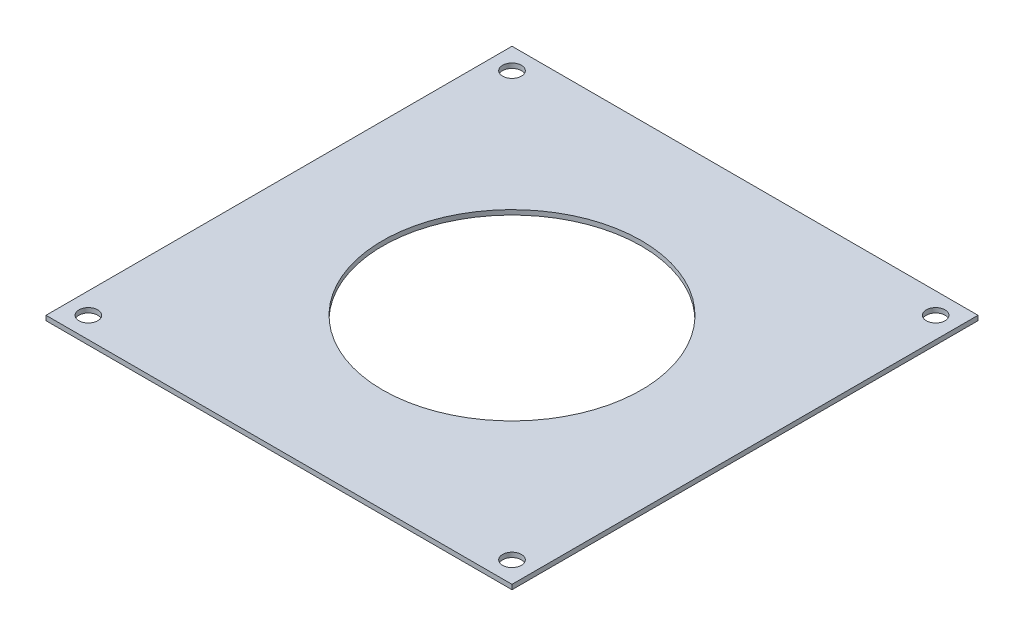
from build123d import *

# Parameters (mm, degrees)
SKETCH1_W           = 98.782817332
SKETCH1_H           = 98.782817332
BOSS_EXTRUDE1_DEPTH = 1.000000032
SKETCH3_R           = 2.000000064
CUT_EXTRUDE2_DEPTH  = 70.85715783
SKETCH4_R           = 27.432
CUT_EXTRUDE3_DEPTH  = 70.85715783


with BuildPart() as part:
    # Sketch1 → Boss-Extrude1 (new body)
    with BuildSketch(Plane(origin=(0, 0, 0), x_dir=(1, 0, 0), z_dir=(0, 1, 0))):
        Rectangle(SKETCH1_W, SKETCH1_H)
    extrude(amount=BOSS_EXTRUDE1_DEPTH)

    # Sketch3 → Cut-Extrude2 (cut, through all)
    with BuildSketch(Plane(origin=(0, 0, 0), x_dir=(1, 0, 0), z_dir=(0, 1, 0))):
        with Locations((44.901280605, 44.901280605)):
            Circle(SKETCH3_R)
        with Locations((44.901280605, -44.901280605)):
            Circle(SKETCH3_R)
        with Locations((-44.901280605, -44.901280605)):
            Circle(SKETCH3_R)
        with Locations((-44.901280605, 44.901280605)):
            Circle(SKETCH3_R)
    extrude(amount=CUT_EXTRUDE2_DEPTH, mode=Mode.SUBTRACT)

    # Sketch4 → Cut-Extrude3 (cut, through all)
    with BuildSketch(Plane(origin=(0, 0, 0), x_dir=(1, 0, 0), z_dir=(0, 1, 0))):
        Circle(SKETCH4_R)
    extrude(amount=CUT_EXTRUDE3_DEPTH, mode=Mode.SUBTRACT)


solid = part.part
